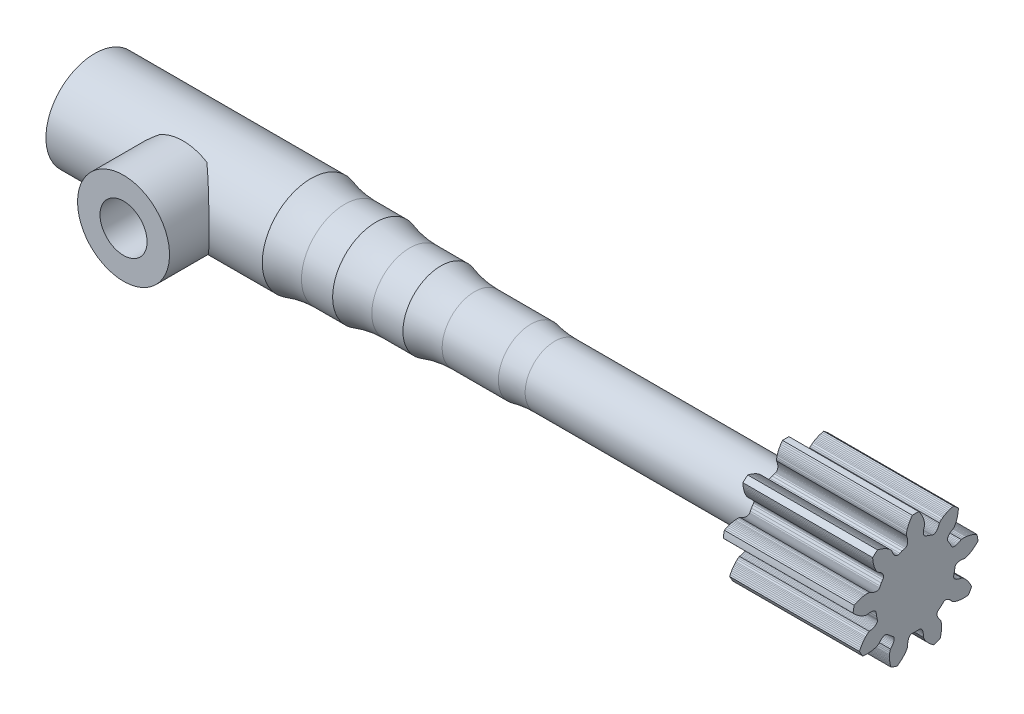
from build123d import *

# Parameters (mm, degrees)
SKETCH1_R           = 4.5
BOSS_EXTRUDE1_DEPTH = 14
SKETCH2_R           = 4.5
BOSS_EXTRUDE2_DEPTH = 6
SKETCH5_R           = 4.25
SKETCH5_R_2         = 2.175
BOSS_EXTRUDE4_DEPTH = 5.5
SKETCH5_2_R         = 2.175
CUT_EXTRUDE2_DEPTH  = 22.711114811
SKETCH3_R           = 4
BOSS_EXTRUDE5_DEPTH = 6
SKETCH6_R           = 3.5
BOSS_EXTRUDE6_DEPTH = 6
SKETCH7_R           = 3
BOSS_EXTRUDE7_DEPTH = 8.32
SKETCH8_R           = 2.75
BOSS_EXTRUDE8_DEPTH = 23.6
BOSS_EXTRUDE9_DEPTH = 12
FILLET1_R           = 10


with BuildPart() as part:
    # Sketch1 → Boss-Extrude1 (new body)
    with BuildSketch(Plane.YZ):
        with Locations(Location((0, 0, 0), (0, 0, 270))):
            Circle(SKETCH1_R)
        with BuildLine():
            Line((-1.509966887, 2.65), (1.509966887, 2.65))
            ThreePointArc((1.509966887, 2.65), (0, -3.05), (-1.509966887, 2.65))
        make_face(mode=Mode.SUBTRACT)
    extrude(amount=BOSS_EXTRUDE1_DEPTH)

    # Sketch2 → Boss-Extrude2 (add)
    with BuildSketch(Plane.YZ.offset(14)):
        with Locations(Location((0, 0, 0), (0, 0, 270))):
            Circle(SKETCH2_R)
    extrude(amount=BOSS_EXTRUDE2_DEPTH)

    # Sketch5 → Boss-Extrude4 (add)
    with BuildSketch(Plane(origin=(0, 0, 2.65), x_dir=(1, 0, 0), z_dir=(0, 0, -1))):
        with Locations(Location((10.825, 0, 0), (0, 0, 180))):
            Circle(SKETCH5_R)
        with Locations(Location((10.825, 0, 0), (0, 0, 180))):
            Circle(SKETCH5_R_2, mode=Mode.SUBTRACT)
    extrude(amount=-BOSS_EXTRUDE4_DEPTH)

    # Sketch5<2> → Cut-Extrude2 (cut, through all)
    with BuildSketch(Plane(origin=(0, 0, 2.65), x_dir=(1, 0, 0), z_dir=(0, 0, -1))):
        with Locations(Location((10.825, 0, 0), (0, 0, 180))):
            Circle(SKETCH5_2_R)
    extrude(amount=-CUT_EXTRUDE2_DEPTH, mode=Mode.SUBTRACT)

    # Sketch3 → Boss-Extrude5 (add)
    with BuildSketch(Plane.YZ.offset(20)):
        with Locations(Location((0, 0, 0), (0, 0, 270))):
            Circle(SKETCH3_R)
    extrude(amount=BOSS_EXTRUDE5_DEPTH)

    # Sketch6 → Boss-Extrude6 (add)
    with BuildSketch(Plane.YZ.offset(26)):
        with Locations(Location((0, 0, 0), (0, 0, 270))):
            Circle(SKETCH6_R)
    extrude(amount=BOSS_EXTRUDE6_DEPTH)

    # Sketch7 → Boss-Extrude7 (add)
    with BuildSketch(Plane.YZ.offset(32)):
        with Locations(Location((0, 0, 0), (0, 0, 270))):
            Circle(SKETCH7_R)
    extrude(amount=BOSS_EXTRUDE7_DEPTH)

    # Sketch8 → Boss-Extrude8 (add)
    with BuildSketch(Plane.YZ.offset(40.32)):
        with Locations(Location((0, 0, 0), (0, 0, 270))):
            Circle(SKETCH8_R)
    extrude(amount=BOSS_EXTRUDE8_DEPTH)

    # Sketch10 → Boss-Extrude9 (add)
    with BuildSketch(Plane.YZ.offset(63.92)):
        with BuildLine():
            Line((-2.112031863, -4.748676017), (-2.204271163, -4.816042317))
            Line((-2.204271163, -4.816042317), (-2.305095463, -4.883377317))
            Line((-2.305095463, -4.883377317), (-2.414536763, -4.950056017))
            Line((-2.414536763, -4.950056017), (-2.534898763, -5.016647017))
            Line((-2.534898763, -5.016647017), (-2.665166763, -5.081714817))
            Line((-2.665166763, -5.081714817), (-2.789429463, -5.137507417))
            ThreePointArc((-2.789429463, -5.137507417), (-3.052505418, -4.994518346), (-3.30787556, -4.838182415))
            Line((-3.30787556, -4.838182415), (-3.321689054, -4.702671401))
            Line((-3.321689054, -4.702671401), (-3.330472754, -4.557322201))
            Line((-3.330472754, -4.557322201), (-3.332984154, -4.419790201))
            Line((-3.332984154, -4.419790201), (-3.329959354, -4.291671901))
            Line((-3.329959354, -4.291671901), (-3.322057754, -4.170687901))
            Line((-3.322057754, -4.170687901), (-3.309836554, -4.057123201))
            Line((-3.309836554, -4.057123201), (-3.294276854, -3.953511001))
            Line((-3.294276854, -3.953511001), (-3.275786654, -3.857778501))
            Line((-3.275786654, -3.857778501), (-3.255029554, -3.770130401))
            Line((-3.255029554, -3.770130401), (-3.209472554, -3.619938701))
            Line((-3.209472554, -3.619938701), (-3.163473654, -3.504126201))
            Line((-3.163473654, -3.504126201), (-3.121645054, -3.419996701))
            Line((-3.121645054, -3.419996701), (-3.097100054, -3.378540701))
            Line((-3.097100054, -3.378540701), (-3.019483654, -3.317785901))
            Line((-3.019483654, -3.317785901), (-2.936160154, -3.245101701))
            Line((-2.936160154, -3.245101701), (-2.863867054, -3.171686701))
            Line((-2.863867054, -3.171686701), (-2.802500554, -3.098302401))
            Line((-2.802500554, -3.098302401), (-2.751910654, -3.025749801))
            Line((-2.751910654, -3.025749801), (-2.711929754, -2.954788901))
            Line((-2.711929754, -2.954788901), (-2.682297754, -2.886180501))
            Line((-2.682297754, -2.886180501), (-2.662751154, -2.820643401))
            Line((-2.662751154, -2.820643401), (-2.652957054, -2.758916501))
            Line((-2.652957054, -2.758916501), (-2.652555954, -2.701677201))
            Line((-2.652555954, -2.701677201), (-2.661138354, -2.649600201))
            Line((-2.661138354, -2.649600201), (-2.678270554, -2.603326601))
            Line((-2.678270554, -2.603326601), (-2.710952354, -2.554592401))
            Line((-2.710952354, -2.554592401), (-2.794320254, -2.468928801))
            Line((-2.794320254, -2.468928801), (-2.941408754, -2.304012301))
            Line((-2.941408754, -2.304012301), (-3.078278154, -2.130521001))
            Line((-3.078278154, -2.130521001), (-3.148163654, -2.033544301))
            Line((-3.148163654, -2.033544301), (-3.190482254, -1.992896401))
            Line((-3.190482254, -1.992896401), (-3.233077854, -1.967989101))
            Line((-3.233077854, -1.967989101), (-3.282873454, -1.950494001))
            Line((-3.282873454, -1.950494001), (-3.339312854, -1.940949601))
            Line((-3.339312854, -1.940949601), (-3.401802654, -1.939876101))
            Line((-3.401802654, -1.939876101), (-3.469738354, -1.947745401))
            Line((-3.469738354, -1.947745401), (-3.542449854, -1.965013501))
            Line((-3.542449854, -1.965013501), (-3.619275454, -1.992064801))
            Line((-3.619275454, -1.992064801), (-3.699510654, -2.029287401))
            Line((-3.699510654, -2.029287401), (-3.782436254, -2.076978601))
            Line((-3.782436254, -2.076978601), (-3.867289454, -2.135425101))
            Line((-3.867289454, -2.135425101), (-3.953338354, -2.204861201))
            Line((-3.953338354, -2.204861201), (-4.026648054, -2.270748501))
            Line((-4.026648054, -2.270748501), (-4.071736554, -2.287721801))
            Line((-4.071736554, -2.287721801), (-4.161851354, -2.314306001))
            Line((-4.161851354, -2.314306001), (-4.283892054, -2.339495401))
            Line((-4.283892054, -2.339495401), (-4.439712854, -2.358279801))
            Line((-4.439712854, -2.358279801), (-4.529633854, -2.363501601))
            Line((-4.529633854, -2.363501601), (-4.627122654, -2.365087201))
            Line((-4.627122654, -2.365087201), (-4.731862654, -2.362418401))
            Line((-4.731862654, -2.362418401), (-4.845824354, -2.354733601))
            Line((-4.845824354, -2.354733601), (-4.966342354, -2.341506601))
            Line((-4.966342354, -2.341506601), (-5.093039554, -2.322237901))
            Line((-5.093039554, -2.322237901), (-5.228046054, -2.295882401))
            Line((-5.228046054, -2.295882401), (-5.369661754, -2.261992601))
            Line((-5.369661754, -2.261992601), (-5.500715354, -2.224857601))
            ThreePointArc((-5.500715354, -2.224857601), (-5.610331599, -1.946219705), (-5.705465656, -1.662310724))
            Line((-5.705465656, -1.662310724), (-5.628942761, -1.549624126))
            Line((-5.628942761, -1.549624126), (-5.542242761, -1.432634126))
            Line((-5.542242761, -1.432634126), (-5.455762761, -1.325664126))
            Line((-5.455762761, -1.325664126), (-5.371092761, -1.229464126))
            Line((-5.371092761, -1.229464126), (-5.287272761, -1.141864126))
            Line((-5.287272761, -1.141864126), (-5.204912761, -1.062724126))
            Line((-5.204912761, -1.062724126), (-5.126392761, -0.993354126))
            Line((-5.126392761, -0.993354126), (-5.050692761, -0.931904126))
            Line((-5.050692761, -0.931904126), (-4.978452761, -0.878104126))
            Line((-4.978452761, -0.878104126), (-4.847012761, -0.792334126))
            Line((-4.847012761, -0.792334126), (-4.737332761, -0.733184126))
            Line((-4.737332761, -0.733184126), (-4.651212761, -0.695624126))
            Line((-4.651212761, -0.695624126), (-4.605762761, -0.679644126))
            Line((-4.605762761, -0.679644126), (-4.507252761, -0.682994126))
            Line((-4.507252761, -0.682994126), (-4.396702761, -0.680874126))
            Line((-4.396702761, -0.680874126), (-4.294132761, -0.671104126))
            Line((-4.294132761, -0.671104126), (-4.199952761, -0.654334126))
            Line((-4.199952761, -0.654334126), (-4.114562761, -0.631274126))
            Line((-4.114562761, -0.631274126), (-4.038322761, -0.602614126))
            Line((-4.038322761, -0.602614126), (-3.971522761, -0.569104126))
            Line((-3.971522761, -0.569104126), (-3.914422761, -0.531464126))
            Line((-3.914422761, -0.531464126), (-3.867242761, -0.490474126))
            Line((-3.867242761, -0.490474126), (-3.830142761, -0.446884126))
            Line((-3.830142761, -0.446884126), (-3.803242761, -0.401474126))
            Line((-3.803242761, -0.401474126), (-3.786622761, -0.355014126))
            Line((-3.786622761, -0.355014126), (-3.780332761, -0.296674126))
            Line((-3.780332761, -0.296674126), (-3.789132761, -0.177464126))
            Line((-3.789132761, -0.177464126), (-3.795802761, 0.043415874))
            Line((-3.795802761, 0.043415874), (-3.789132761, 0.264295874))
            Line((-3.789132761, 0.264295874), (-3.780332761, 0.383505874))
            Line((-3.780332761, 0.383505874), (-3.786622761, 0.441845874))
            Line((-3.786622761, 0.441845874), (-3.803242761, 0.488305874))
            Line((-3.803242761, 0.488305874), (-3.830142761, 0.533715874))
            Line((-3.830142761, 0.533715874), (-3.867242761, 0.577305874))
            Line((-3.867242761, 0.577305874), (-3.914422761, 0.618295874))
            Line((-3.914422761, 0.618295874), (-3.971522761, 0.655935874))
            Line((-3.971522761, 0.655935874), (-4.038322761, 0.689445874))
            Line((-4.038322761, 0.689445874), (-4.114562761, 0.718105874))
            Line((-4.114562761, 0.718105874), (-4.199952761, 0.741165874))
            Line((-4.199952761, 0.741165874), (-4.294132761, 0.757935874))
            Line((-4.294132761, 0.757935874), (-4.396702761, 0.767705874))
            Line((-4.396702761, 0.767705874), (-4.507252761, 0.769825874))
            Line((-4.507252761, 0.769825874), (-4.605762761, 0.766475874))
            Line((-4.605762761, 0.766475874), (-4.651212761, 0.782455874))
            Line((-4.651212761, 0.782455874), (-4.737332761, 0.820015874))
            Line((-4.737332761, 0.820015874), (-4.847012761, 0.879165874))
            Line((-4.847012761, 0.879165874), (-4.978452761, 0.964935874))
            Line((-4.978452761, 0.964935874), (-5.050692761, 1.018735874))
            Line((-5.050692761, 1.018735874), (-5.126392761, 1.080185874))
            Line((-5.126392761, 1.080185874), (-5.204912761, 1.149555874))
            Line((-5.204912761, 1.149555874), (-5.287272761, 1.228695874))
            Line((-5.287272761, 1.228695874), (-5.371092761, 1.316295874))
            Line((-5.371092761, 1.316295874), (-5.455762761, 1.412495874))
            Line((-5.455762761, 1.412495874), (-5.542242761, 1.519465874))
            Line((-5.542242761, 1.519465874), (-5.628942761, 1.636455874))
            Line((-5.628942761, 1.636455874), (-5.705465661, 1.749142474))
            ThreePointArc((-5.705465661, 1.749142474), (-5.610331604, 2.033051466), (-5.500715357, 2.311689372))
            Line((-5.500715357, 2.311689372), (-5.369661767, 2.348824376))
            Line((-5.369661767, 2.348824376), (-5.228046067, 2.382714176))
            Line((-5.228046067, 2.382714176), (-5.093039567, 2.409069676))
            Line((-5.093039567, 2.409069676), (-4.966342367, 2.428338376))
            Line((-4.966342367, 2.428338376), (-4.845824367, 2.441565376))
            Line((-4.845824367, 2.441565376), (-4.731862667, 2.449250176))
            Line((-4.731862667, 2.449250176), (-4.627122667, 2.451918976))
            Line((-4.627122667, 2.451918976), (-4.529633867, 2.450333376))
            Line((-4.529633867, 2.450333376), (-4.439712867, 2.445111576))
            Line((-4.439712867, 2.445111576), (-4.283892067, 2.426327176))
            Line((-4.283892067, 2.426327176), (-4.161851367, 2.401137776))
            Line((-4.161851367, 2.401137776), (-4.071736567, 2.374553576))
            Line((-4.071736567, 2.374553576), (-4.026648067, 2.357580276))
            Line((-4.026648067, 2.357580276), (-3.953338367, 2.291692976))
            Line((-3.953338367, 2.291692976), (-3.867289467, 2.222256876))
            Line((-3.867289467, 2.222256876), (-3.782436267, 2.163810376))
            Line((-3.782436267, 2.163810376), (-3.699510667, 2.116119176))
            Line((-3.699510667, 2.116119176), (-3.619275467, 2.078896576))
            Line((-3.619275467, 2.078896576), (-3.542449867, 2.051845276))
            Line((-3.542449867, 2.051845276), (-3.469738367, 2.034577176))
            Line((-3.469738367, 2.034577176), (-3.401802667, 2.026707876))
            Line((-3.401802667, 2.026707876), (-3.339312867, 2.027781376))
            Line((-3.339312867, 2.027781376), (-3.282873467, 2.037325776))
            Line((-3.282873467, 2.037325776), (-3.233077867, 2.054820876))
            Line((-3.233077867, 2.054820876), (-3.190482267, 2.079728176))
            Line((-3.190482267, 2.079728176), (-3.148163667, 2.120376076))
            Line((-3.148163667, 2.120376076), (-3.078278167, 2.217352776))
            Line((-3.078278167, 2.217352776), (-2.941408767, 2.390844076))
            Line((-2.941408767, 2.390844076), (-2.794320267, 2.555760576))
            Line((-2.794320267, 2.555760576), (-2.710952367, 2.641424176))
            Line((-2.710952367, 2.641424176), (-2.678270567, 2.690158376))
            Line((-2.678270567, 2.690158376), (-2.661138367, 2.736431976))
            Line((-2.661138367, 2.736431976), (-2.652555967, 2.788508976))
            Line((-2.652555967, 2.788508976), (-2.652957067, 2.845748276))
            Line((-2.652957067, 2.845748276), (-2.662751167, 2.907475176))
            Line((-2.662751167, 2.907475176), (-2.682297767, 2.973012276))
            Line((-2.682297767, 2.973012276), (-2.711929767, 3.041620676))
            Line((-2.711929767, 3.041620676), (-2.751910667, 3.112581576))
            Line((-2.751910667, 3.112581576), (-2.802500567, 3.185134176))
            Line((-2.802500567, 3.185134176), (-2.863867067, 3.258518476))
            Line((-2.863867067, 3.258518476), (-2.936160167, 3.331933476))
            Line((-2.936160167, 3.331933476), (-3.019483667, 3.404617676))
            Line((-3.019483667, 3.404617676), (-3.097100067, 3.465372476))
            Line((-3.097100067, 3.465372476), (-3.121645067, 3.506828476))
            Line((-3.121645067, 3.506828476), (-3.163473667, 3.590957976))
            Line((-3.163473667, 3.590957976), (-3.209472567, 3.706770476))
            Line((-3.209472567, 3.706770476), (-3.255029567, 3.856962176))
            Line((-3.255029567, 3.856962176), (-3.275786667, 3.944610276))
            Line((-3.275786667, 3.944610276), (-3.294276867, 4.040342776))
            Line((-3.294276867, 4.040342776), (-3.309836567, 4.143954976))
            Line((-3.309836567, 4.143954976), (-3.322057767, 4.257519676))
            Line((-3.322057767, 4.257519676), (-3.329959367, 4.378503676))
            Line((-3.329959367, 4.378503676), (-3.332984167, 4.506621976))
            Line((-3.332984167, 4.506621976), (-3.330472767, 4.644153976))
            Line((-3.330472767, 4.644153976), (-3.321689067, 4.789503176))
            Line((-3.321689067, 4.789503176), (-3.307875567, 4.925014176))
            ThreePointArc((-3.307875567, 4.925014176), (-3.052505426, 5.081350107), (-2.789429471, 5.224339178))
            Line((-2.789429471, 5.224339178), (-2.665166759, 5.168546563))
            Line((-2.665166759, 5.168546563), (-2.534898759, 5.103478763))
            Line((-2.534898759, 5.103478763), (-2.414536759, 5.036887763))
            Line((-2.414536759, 5.036887763), (-2.305095459, 4.970209063))
            Line((-2.305095459, 4.970209063), (-2.204271159, 4.902874063))
            Line((-2.204271159, 4.902874063), (-2.112031859, 4.835507763))
            Line((-2.112031859, 4.835507763), (-2.030080859, 4.770226663))
            Line((-2.030080859, 4.770226663), (-1.956419259, 4.706347363))
            Line((-1.956419259, 4.706347363), (-1.890892259, 4.644547163))
            Line((-1.890892259, 4.644547163), (-1.783600959, 4.529997863))
            Line((-1.783600959, 4.529997863), (-1.706303859, 4.432255363))
            Line((-1.706303859, 4.432255363), (-1.654359859, 4.353965963))
            Line((-1.654359859, 4.353965963), (-1.630730359, 4.311981363))
            Line((-1.630730359, 4.311981363), (-1.616923359, 4.214386263))
            Line((-1.616923359, 4.214386263), (-1.595638759, 4.105883863))
            Line((-1.595638759, 4.105883863), (-1.568206159, 4.006568663))
            Line((-1.568206159, 4.006568663), (-1.535336659, 3.916731563))
            Line((-1.535336659, 3.916731563), (-1.497799259, 3.836643163))
            Line((-1.497799259, 3.836643163), (-1.456335659, 3.766538163))
            Line((-1.456335659, 3.766538163), (-1.411735059, 3.706571963))
            Line((-1.411735059, 3.706571963), (-1.364751559, 3.656875563))
            Line((-1.364751559, 3.656875563), (-1.316191659, 3.617530163))
            Line((-1.316191659, 3.617530163), (-1.266821459, 3.588563163))
            Line((-1.266821459, 3.588563163), (-1.217430259, 3.569957163))
            Line((-1.217430259, 3.569957163), (-1.168790059, 3.561657363))
            Line((-1.168790059, 3.561657363), (-1.110244159, 3.565593563))
            Line((-1.110244159, 3.565593563), (-0.994373259, 3.594960463))
            Line((-0.994373259, 3.594960463), (-0.778007159, 3.639884563))
            Line((-0.778007159, 3.639884563), (-0.559324559, 3.671671263))
            Line((-0.559324559, 3.671671263), (-0.440397559, 3.683705563))
            Line((-0.440397559, 3.683705563), (-0.384036159, 3.700030663))
            Line((-0.384036159, 3.700030663), (-0.341167959, 3.724465863))
            Line((-0.341167959, 3.724465863), (-0.301119059, 3.758842563))
            Line((-0.301119059, 3.758842563), (-0.264633559, 3.802948263))
            Line((-0.264633559, 3.802948263), (-0.232459059, 3.856529263))
            Line((-0.232459059, 3.856529263), (-0.205306159, 3.919297963))
            Line((-0.205306159, 3.919297963), (-0.183904959, 3.990902063))
            Line((-0.183904959, 3.990902063), (-0.168919359, 4.070960563))
            Line((-0.168919359, 4.070960563), (-0.161037459, 4.159057563))
            Line((-0.161037459, 4.159057563), (-0.160876459, 4.254718863))
            Line((-0.160876459, 4.254718863), (-0.169065959, 4.357427163))
            Line((-0.169065959, 4.357427163), (-0.186174959, 4.466665763))
            Line((-0.186174959, 4.466665763), (-0.206580159, 4.563097463))
            Line((-0.206580159, 4.563097463), (-0.198735259, 4.610631863))
            Line((-0.198735259, 4.610631863), (-0.176700459, 4.701965763))
            Line((-0.176700459, 4.701965763), (-0.137494759, 4.820250763))
            Line((-0.137494759, 4.820250763), (-0.075852159, 4.964587663))
            Line((-0.075852159, 4.964587663), (-0.035413859, 5.045072463))
            Line((-0.035413859, 5.045072463), (0.011957441, 5.130293063))
            Line((0.011957441, 5.130293063), (0.066638641, 5.219666163))
            Line((0.066638641, 5.219666163), (0.130274741, 5.314517463))
            Line((0.130274741, 5.314517463), (0.201988641, 5.412275663))
            Line((0.201988641, 5.412275663), (0.282024441, 5.512364263))
            Line((0.282024441, 5.512364263), (0.372352141, 5.616105563))
            Line((0.372352141, 5.616105563), (0.472509541, 5.721803563))
            Line((0.472509541, 5.721803563), (0.570196141, 5.816731763))
            ThreePointArc((0.570196141, 5.816731763), (0.86631179, 5.772343254), (1.159751238, 5.712777258))
            Line((1.159751238, 5.712777258), (1.219079135, 5.59016313))
            Line((1.219079135, 5.59016313), (1.277045435, 5.45658373))
            Line((1.277045435, 5.45658373), (1.326444235, 5.32820483))
            Line((1.326444235, 5.32820483), (1.367420835, 5.20677843))
            Line((1.367420835, 5.20677843), (1.401374735, 5.09038823))
            Line((1.401374735, 5.09038823), (1.428731935, 4.97949233))
            Line((1.428731935, 4.97949233), (1.449548135, 4.87680703))
            Line((1.449548135, 4.87680703), (1.464915335, 4.78052393))
            Line((1.464915335, 4.78052393), (1.475387535, 4.69106223))
            Line((1.475387535, 4.69106223), (1.483946535, 4.53434683))
            Line((1.483946535, 4.53434683), (1.480331935, 4.40978623))
            Line((1.480331935, 4.40978623), (1.469799835, 4.31642413))
            Line((1.469799835, 4.31642413), (1.460913935, 4.26907323))
            Line((1.460913935, 4.26907323), (1.408757735, 4.18543603))
            Line((1.408757735, 4.18543603), (1.355318735, 4.08863693))
            Line((1.355318735, 4.08863693), (1.312494835, 3.99492373))
            Line((1.312494835, 3.99492373), (1.279928035, 3.90497643))
            Line((1.279928035, 3.90497643), (1.257203635, 3.81949653))
            Line((1.257203635, 3.81949653), (1.243903935, 3.73914083))
            Line((1.243903935, 3.73914083), (1.239524435, 3.66453533))
            Line((1.239524435, 3.66453533), (1.243571635, 3.59626523))
            Line((1.243571635, 3.59626523), (1.255479935, 3.53491113))
            Line((1.255479935, 3.53491113), (1.274680035, 3.48098663))
            Line((1.274680035, 3.48098663), (1.300556235, 3.43498553))
            Line((1.300556235, 3.43498553), (1.332481735, 3.39736223))
            Line((1.332481735, 3.39736223), (1.379860735, 3.36274493))
            Line((1.379860735, 3.36274493), (1.487499635, 3.31076093))
            Line((1.487499635, 3.31076093), (1.682122235, 3.20609733))
            Line((1.682122235, 3.20609733), (1.870074935, 3.08988093))
            Line((1.870074935, 3.08988093), (1.968913835, 3.02265493))
            Line((1.968913835, 3.02265493), (2.022582735, 2.99893223))
            Line((2.022582735, 2.99893223), (2.071128335, 2.99009553))
            Line((2.071128335, 2.99009553), (2.123904535, 2.99068663))
            Line((2.123904535, 2.99068663), (2.180204535, 3.00102113))
            Line((2.180204535, 3.00102113), (2.239292935, 3.02138523))
            Line((2.239292935, 3.02138523), (2.300440135, 3.05201533))
            Line((2.300440135, 3.05201533), (2.362860635, 3.09311083))
            Line((2.362860635, 3.09311083), (2.425800935, 3.14480653))
            Line((2.425800935, 3.14480653), (2.488466535, 3.20722643))
            Line((2.488466535, 3.20722643), (2.550079735, 3.28040373))
            Line((2.550079735, 3.28040373), (2.609825835, 3.36434693))
            Line((2.609825835, 3.36434693), (2.666936835, 3.45902603))
            Line((2.666936835, 3.45902603), (2.713290635, 3.54601323))
            Line((2.713290635, 3.54601323), (2.749854735, 3.57738413))
            Line((2.749854735, 3.57738413), (2.825442635, 3.63318623))
            Line((2.825442635, 3.63318623), (2.931508035, 3.69859683))
            Line((2.931508035, 3.69859683), (3.071507035, 3.76954223))
            Line((3.071507035, 3.76954223), (3.154219135, 3.80520393))
            Line((3.154219135, 3.80520393), (3.245286435, 3.84003703))
            Line((3.245286435, 3.84003703), (3.344622635, 3.87335233))
            Line((3.344622635, 3.87335233), (3.454339835, 3.90510823))
            Line((3.454339835, 3.90510823), (3.572113735, 3.93389843))
            Line((3.572113735, 3.93389843), (3.697760335, 3.95912483))
            Line((3.697760335, 3.95912483), (3.833639035, 3.98053373))
            Line((3.833639035, 3.98053373), (3.978305435, 3.99712313))
            Line((3.978305435, 3.99712313), (4.114156335, 4.00705063))
            ThreePointArc((4.114156335, 4.00705063), (4.312461733, 3.782707584), (4.498961139, 3.548458134))
            Line((4.498961139, 3.548458134), (4.465594135, 3.416395031))
            Line((4.465594135, 3.416395031), (4.424135735, 3.276807231))
            Line((4.424135735, 3.276807231), (4.379456935, 3.146710431))
            Line((4.379456935, 3.146710431), (4.332795535, 3.027353131))
            Line((4.332795535, 3.027353131), (4.283991435, 2.916367931))
            Line((4.283991435, 2.916367931), (4.233665835, 2.813831931))
            Line((4.233665835, 2.813831931), (4.183607135, 2.721790031))
            Line((4.183607135, 2.721790031), (4.133489535, 2.638154931))
            Line((4.133489535, 2.638154931), (4.084006835, 2.562891931))
            Line((4.084006835, 2.562891931), (3.989828735, 2.437339431))
            Line((3.989828735, 2.437339431), (3.906993735, 2.344243831))
            Line((3.906993735, 2.344243831), (3.838913635, 2.279494131))
            Line((3.838913635, 2.279494131), (3.801670135, 2.248933031))
            Line((3.801670135, 2.248933031), (3.707955235, 2.218388631))
            Line((3.707955235, 2.218388631), (3.604797235, 2.178586131))
            Line((3.604797235, 2.178586131), (3.511754535, 2.134324331))
            Line((3.511754535, 2.134324331), (3.428989935, 2.086354231))
            Line((3.428989935, 2.086354231), (3.356636635, 2.035479831))
            Line((3.356636635, 2.035479831), (3.294796735, 1.982472631))
            Line((3.294796735, 1.982472631), (3.243486335, 1.928136631))
            Line((3.243486335, 1.928136631), (3.202703535, 1.873237231))
            Line((3.202703535, 1.873237231), (3.172388235, 1.818582731))
            Line((3.172388235, 1.818582731), (3.152434335, 1.764932531))
            Line((3.152434335, 1.764932531), (3.142687735, 1.713060731))
            Line((3.142687735, 1.713060731), (3.142960235, 1.663718231))
            Line((3.142960235, 1.663718231), (3.157003035, 1.606745331))
            Line((3.157003035, 1.606745331), (3.206044635, 1.497734331))
            Line((3.206044635, 1.497734331), (3.287857735, 1.292456331))
            Line((3.287857735, 1.292456331), (3.357135435, 1.082615731))
            Line((3.357135435, 1.082615731), (3.389638335, 0.967585131))
            Line((3.389638335, 0.967585131), (3.415502435, 0.914914831))
            Line((3.415502435, 0.914914831), (3.447010435, 0.876941031))
            Line((3.447010435, 0.876941031), (3.487819235, 0.843469931))
            Line((3.487819235, 0.843469931), (3.537590535, 0.815197731))
            Line((3.537590535, 0.815197731), (3.595944635, 0.792816231))
            Line((3.595944635, 0.792816231), (3.662474735, 0.776975531))
            Line((3.662474735, 0.776975531), (3.736707235, 0.768333431))
            Line((3.736707235, 0.768333431), (3.818151735, 0.767477431))
            Line((3.818151735, 0.767477431), (3.906279035, 0.775013231))
            Line((3.906279035, 0.775013231), (4.000515035, 0.791466031))
            Line((4.000515035, 0.791466031), (4.100240835, 0.817366231))
            Line((4.100240835, 0.817366231), (4.204848935, 0.853184431))
            Line((4.204848935, 0.853184431), (4.296272235, 0.890024831))
            Line((4.296272235, 0.890024831), (4.344446735, 0.890553331))
            Line((4.344446735, 0.890553331), (4.438219335, 0.884713231))
            Line((4.438219335, 0.884713231), (4.561515335, 0.866643131))
            Line((4.561515335, 0.866643131), (4.714363635, 0.831000831))
            Line((4.714363635, 0.831000831), (4.800647735, 0.805152931))
            Line((4.800647735, 0.805152931), (4.892799535, 0.773299731))
            Line((4.892799535, 0.773299731), (4.990310135, 0.734968731))
            Line((4.990310135, 0.734968731), (5.094770735, 0.688770231))
            Line((5.094770735, 0.688770231), (5.203496735, 0.635121231))
            Line((5.203496735, 0.635121231), (5.315962835, 0.573681631))
            Line((5.315962835, 0.573681631), (5.433813335, 0.502740631))
            Line((5.433813335, 0.502740631), (5.555297635, 0.422459131))
            Line((5.555297635, 0.422459131), (5.665746835, 0.342740831))
            ThreePointArc((5.665746835, 0.342740831), (5.673452649, 0.043415831), (5.665746835, -0.255909169))
            Line((5.665746835, -0.255909169), (5.555297649, -0.335627469))
            Line((5.555297649, -0.335627469), (5.433813349, -0.415908969))
            Line((5.433813349, -0.415908969), (5.315962849, -0.486849969))
            Line((5.315962849, -0.486849969), (5.203496749, -0.548289569))
            Line((5.203496749, -0.548289569), (5.094770749, -0.601938569))
            Line((5.094770749, -0.601938569), (4.990310149, -0.648137069))
            Line((4.990310149, -0.648137069), (4.892799549, -0.686468069))
            Line((4.892799549, -0.686468069), (4.800647749, -0.718321269))
            Line((4.800647749, -0.718321269), (4.714363649, -0.744169169))
            Line((4.714363649, -0.744169169), (4.561515349, -0.779811469))
            Line((4.561515349, -0.779811469), (4.438219349, -0.797881569))
            Line((4.438219349, -0.797881569), (4.344446749, -0.803721669))
            Line((4.344446749, -0.803721669), (4.296272249, -0.803193169))
            Line((4.296272249, -0.803193169), (4.204848949, -0.766352769))
            Line((4.204848949, -0.766352769), (4.100240849, -0.730534569))
            Line((4.100240849, -0.730534569), (4.000515049, -0.704634369))
            Line((4.000515049, -0.704634369), (3.906279049, -0.688181569))
            Line((3.906279049, -0.688181569), (3.818151749, -0.680645769))
            Line((3.818151749, -0.680645769), (3.736707249, -0.681501769))
            Line((3.736707249, -0.681501769), (3.662474749, -0.690143869))
            Line((3.662474749, -0.690143869), (3.595944649, -0.705984569))
            Line((3.595944649, -0.705984569), (3.537590549, -0.728366069))
            Line((3.537590549, -0.728366069), (3.487819249, -0.756638269))
            Line((3.487819249, -0.756638269), (3.447010449, -0.790109369))
            Line((3.447010449, -0.790109369), (3.415502449, -0.828083169))
            Line((3.415502449, -0.828083169), (3.389638349, -0.880753469))
            Line((3.389638349, -0.880753469), (3.357135449, -0.995784069))
            Line((3.357135449, -0.995784069), (3.287857749, -1.205624669))
            Line((3.287857749, -1.205624669), (3.206044649, -1.410902669))
            Line((3.206044649, -1.410902669), (3.157003049, -1.519913669))
            Line((3.157003049, -1.519913669), (3.142960249, -1.576886569))
            Line((3.142960249, -1.576886569), (3.142687749, -1.626229069))
            Line((3.142687749, -1.626229069), (3.152434349, -1.678100869))
            Line((3.152434349, -1.678100869), (3.172388249, -1.731751069))
            Line((3.172388249, -1.731751069), (3.202703549, -1.786405569))
            Line((3.202703549, -1.786405569), (3.243486349, -1.841304969))
            Line((3.243486349, -1.841304969), (3.294796749, -1.895640969))
            Line((3.294796749, -1.895640969), (3.356636649, -1.948648169))
            Line((3.356636649, -1.948648169), (3.428989949, -1.999522569))
            Line((3.428989949, -1.999522569), (3.511754549, -2.047492669))
            Line((3.511754549, -2.047492669), (3.604797249, -2.091754469))
            Line((3.604797249, -2.091754469), (3.707955249, -2.131556969))
            Line((3.707955249, -2.131556969), (3.801670149, -2.162101369))
            Line((3.801670149, -2.162101369), (3.838913649, -2.192662469))
            Line((3.838913649, -2.192662469), (3.906993749, -2.257412169))
            Line((3.906993749, -2.257412169), (3.989828749, -2.350507769))
            Line((3.989828749, -2.350507769), (4.084006849, -2.476060269))
            Line((4.084006849, -2.476060269), (4.133489549, -2.551323269))
            Line((4.133489549, -2.551323269), (4.183607149, -2.634958369))
            Line((4.183607149, -2.634958369), (4.233665849, -2.727000269))
            Line((4.233665849, -2.727000269), (4.283991449, -2.829536269))
            Line((4.283991449, -2.829536269), (4.332795549, -2.940521469))
            Line((4.332795549, -2.940521469), (4.379456949, -3.059878769))
            Line((4.379456949, -3.059878769), (4.424135749, -3.189975569))
            Line((4.424135749, -3.189975569), (4.465594149, -3.329563369))
            Line((4.465594149, -3.329563369), (4.498961149, -3.461626469))
            ThreePointArc((4.498961149, -3.461626469), (4.312461745, -3.695875918), (4.114156348, -3.920218963))
            Line((4.114156348, -3.920218963), (3.978305446, -3.910291466))
            Line((3.978305446, -3.910291466), (3.833639046, -3.893702066))
            Line((3.833639046, -3.893702066), (3.697760346, -3.872293166))
            Line((3.697760346, -3.872293166), (3.572113746, -3.847066766))
            Line((3.572113746, -3.847066766), (3.454339846, -3.818276566))
            Line((3.454339846, -3.818276566), (3.344622646, -3.786520666))
            Line((3.344622646, -3.786520666), (3.245286446, -3.753205366))
            Line((3.245286446, -3.753205366), (3.154219146, -3.718372266))
            Line((3.154219146, -3.718372266), (3.071507046, -3.682710566))
            Line((3.071507046, -3.682710566), (2.931508046, -3.611765166))
            Line((2.931508046, -3.611765166), (2.825442646, -3.546354566))
            Line((2.825442646, -3.546354566), (2.749854746, -3.490552466))
            Line((2.749854746, -3.490552466), (2.713290646, -3.459181566))
            Line((2.713290646, -3.459181566), (2.666936846, -3.372194366))
            Line((2.666936846, -3.372194366), (2.609825846, -3.277515266))
            Line((2.609825846, -3.277515266), (2.550079746, -3.193572066))
            Line((2.550079746, -3.193572066), (2.488466546, -3.120394766))
            Line((2.488466546, -3.120394766), (2.425800946, -3.057974866))
            Line((2.425800946, -3.057974866), (2.362860646, -3.006279166))
            Line((2.362860646, -3.006279166), (2.300440146, -2.965183666))
            Line((2.300440146, -2.965183666), (2.239292946, -2.934553566))
            Line((2.239292946, -2.934553566), (2.180204546, -2.914189466))
            Line((2.180204546, -2.914189466), (2.123904546, -2.903854966))
            Line((2.123904546, -2.903854966), (2.071128346, -2.903263866))
            Line((2.071128346, -2.903263866), (2.022582746, -2.912100566))
            Line((2.022582746, -2.912100566), (1.968913846, -2.935823266))
            Line((1.968913846, -2.935823266), (1.870074946, -3.003049266))
            Line((1.870074946, -3.003049266), (1.682122246, -3.119265666))
            Line((1.682122246, -3.119265666), (1.487499646, -3.223929266))
            Line((1.487499646, -3.223929266), (1.379860746, -3.275913266))
            Line((1.379860746, -3.275913266), (1.332481746, -3.310530566))
            Line((1.332481746, -3.310530566), (1.300556246, -3.348153866))
            Line((1.300556246, -3.348153866), (1.274680046, -3.394154966))
            Line((1.274680046, -3.394154966), (1.255479946, -3.448079466))
            Line((1.255479946, -3.448079466), (1.243571646, -3.509433566))
            Line((1.243571646, -3.509433566), (1.239524446, -3.577703666))
            Line((1.239524446, -3.577703666), (1.243903946, -3.652309166))
            Line((1.243903946, -3.652309166), (1.257203646, -3.732664866))
            Line((1.257203646, -3.732664866), (1.279928046, -3.818144766))
            Line((1.279928046, -3.818144766), (1.312494846, -3.908092066))
            Line((1.312494846, -3.908092066), (1.355318746, -4.001805266))
            Line((1.355318746, -4.001805266), (1.408757746, -4.098604366))
            Line((1.408757746, -4.098604366), (1.460913946, -4.182241566))
            Line((1.460913946, -4.182241566), (1.469799846, -4.229592466))
            Line((1.469799846, -4.229592466), (1.480331946, -4.322954566))
            Line((1.480331946, -4.322954566), (1.483946546, -4.447515166))
            Line((1.483946546, -4.447515166), (1.475387546, -4.604230566))
            Line((1.475387546, -4.604230566), (1.464915346, -4.693692266))
            Line((1.464915346, -4.693692266), (1.449548146, -4.789975366))
            Line((1.449548146, -4.789975366), (1.428731946, -4.892660666))
            Line((1.428731946, -4.892660666), (1.401374746, -5.003556566))
            Line((1.401374746, -5.003556566), (1.367420846, -5.119946766))
            Line((1.367420846, -5.119946766), (1.326444246, -5.241373166))
            Line((1.326444246, -5.241373166), (1.277045446, -5.369752066))
            Line((1.277045446, -5.369752066), (1.219079146, -5.503331466))
            Line((1.219079146, -5.503331466), (1.159751246, -5.625945566))
            ThreePointArc((1.159751246, -5.625945566), (0.866311796, -5.685511558), (0.570196145, -5.729900062))
            Line((0.570196145, -5.729900062), (0.472509537, -5.634971817))
            Line((0.472509537, -5.634971817), (0.372352137, -5.529273817))
            Line((0.372352137, -5.529273817), (0.282024437, -5.425532517))
            Line((0.282024437, -5.425532517), (0.201988637, -5.325443917))
            Line((0.201988637, -5.325443917), (0.130274737, -5.227685717))
            Line((0.130274737, -5.227685717), (0.066638637, -5.132834417))
            Line((0.066638637, -5.132834417), (0.011957437, -5.043461317))
            Line((0.011957437, -5.043461317), (-0.035413863, -4.958240717))
            Line((-0.035413863, -4.958240717), (-0.075852163, -4.877755917))
            Line((-0.075852163, -4.877755917), (-0.137494763, -4.733419017))
            Line((-0.137494763, -4.733419017), (-0.176700463, -4.615134017))
            Line((-0.176700463, -4.615134017), (-0.198735263, -4.523800117))
            Line((-0.198735263, -4.523800117), (-0.206580163, -4.476265717))
            Line((-0.206580163, -4.476265717), (-0.186174963, -4.379834017))
            Line((-0.186174963, -4.379834017), (-0.169065963, -4.270595417))
            Line((-0.169065963, -4.270595417), (-0.160876463, -4.167887117))
            Line((-0.160876463, -4.167887117), (-0.161037463, -4.072225817))
            Line((-0.161037463, -4.072225817), (-0.168919363, -3.984128817))
            Line((-0.168919363, -3.984128817), (-0.183904963, -3.904070317))
            Line((-0.183904963, -3.904070317), (-0.205306163, -3.832466217))
            Line((-0.205306163, -3.832466217), (-0.232459063, -3.769697517))
            Line((-0.232459063, -3.769697517), (-0.264633563, -3.716116517))
            Line((-0.264633563, -3.716116517), (-0.301119063, -3.672010817))
            Line((-0.301119063, -3.672010817), (-0.341167963, -3.637634117))
            Line((-0.341167963, -3.637634117), (-0.384036163, -3.613198917))
            Line((-0.384036163, -3.613198917), (-0.440397563, -3.596873817))
            Line((-0.440397563, -3.596873817), (-0.559324563, -3.584839517))
            Line((-0.559324563, -3.584839517), (-0.778007163, -3.553052817))
            Line((-0.778007163, -3.553052817), (-0.994373263, -3.508128717))
            Line((-0.994373263, -3.508128717), (-1.110244163, -3.478761817))
            Line((-1.110244163, -3.478761817), (-1.168790063, -3.474825617))
            Line((-1.168790063, -3.474825617), (-1.217430263, -3.483125417))
            Line((-1.217430263, -3.483125417), (-1.266821463, -3.501731417))
            Line((-1.266821463, -3.501731417), (-1.316191663, -3.530698417))
            Line((-1.316191663, -3.530698417), (-1.364751563, -3.570043817))
            Line((-1.364751563, -3.570043817), (-1.411735063, -3.619740217))
            Line((-1.411735063, -3.619740217), (-1.456335663, -3.679706417))
            Line((-1.456335663, -3.679706417), (-1.497799263, -3.749811417))
            Line((-1.497799263, -3.749811417), (-1.535336663, -3.829899817))
            Line((-1.535336663, -3.829899817), (-1.568206163, -3.919736917))
            Line((-1.568206163, -3.919736917), (-1.595638763, -4.019052117))
            Line((-1.595638763, -4.019052117), (-1.616923363, -4.127554517))
            Line((-1.616923363, -4.127554517), (-1.630730363, -4.225149617))
            Line((-1.630730363, -4.225149617), (-1.654359863, -4.267134217))
            Line((-1.654359863, -4.267134217), (-1.706303863, -4.345423617))
            Line((-1.706303863, -4.345423617), (-1.783600963, -4.443166117))
            Line((-1.783600963, -4.443166117), (-1.890892263, -4.557715417))
            Line((-1.890892263, -4.557715417), (-1.956419263, -4.619515617))
            Line((-1.956419263, -4.619515617), (-2.030080863, -4.683394917))
            Line((-2.030080863, -4.683394917), (-2.112031863, -4.748676017))
        make_face()
    extrude(amount=BOSS_EXTRUDE9_DEPTH)

    # Fillet1
    # the kernel refuses this fillet: 10 mm, written as the material it adds along each edge
    with BuildSketch(Plane(origin=(20, 0, 0), x_dir=(0, 0, -1), z_dir=(0, -1, 0))) as fillet1_piece_1:
        with BuildLine():
            CenterArc((14, 3.122498999), FILLET1_R, 180, 18.194872339)
            Line((4.5, 0), (4, 0))
            Line((4, 0), (4, 3.122498999))
        make_face()
    revolve(axis=Axis((20, 0, 0), (1, 0, 0)))
    with BuildSketch(Plane(origin=(26, 0, 0), x_dir=(0, 0, -1), z_dir=(0, -1, 0))) as fillet1_piece_2:
        with BuildLine():
            CenterArc((13.5, 3.122498999), FILLET1_R, 180, 18.194872339)
            Line((4, 0), (3.5, 0))
            Line((3.5, 0), (3.5, 3.122498999))
        make_face()
    revolve(axis=Axis((26, 0, 0), (1, 0, 0)))
    with BuildSketch(Plane(origin=(32, 0, 0), x_dir=(0, 0, -1), z_dir=(0, -1, 0))) as fillet1_piece_3:
        with BuildLine():
            CenterArc((13, 3.122498999), FILLET1_R, 180, 18.194872339)
            Line((3.5, 0), (3, 0))
            Line((3, 0), (3, 3.122498999))
        make_face()
    revolve(axis=Axis((32, 0, 0), (1, 0, 0)))
    with BuildSketch(Plane(origin=(40.32, 0, 0), x_dir=(0, 0, -1), z_dir=(0, -1, 0))) as fillet1_piece_4:
        with BuildLine():
            CenterArc((12.75, 2.222048604), FILLET1_R, 180, 12.838568141)
            Line((3, 0), (2.75, 0))
            Line((2.75, 0), (2.75, 2.222048604))
        make_face()
    revolve(axis=Axis((40.32, 0, 0), (1, 0, 0)))


solid = part.part
